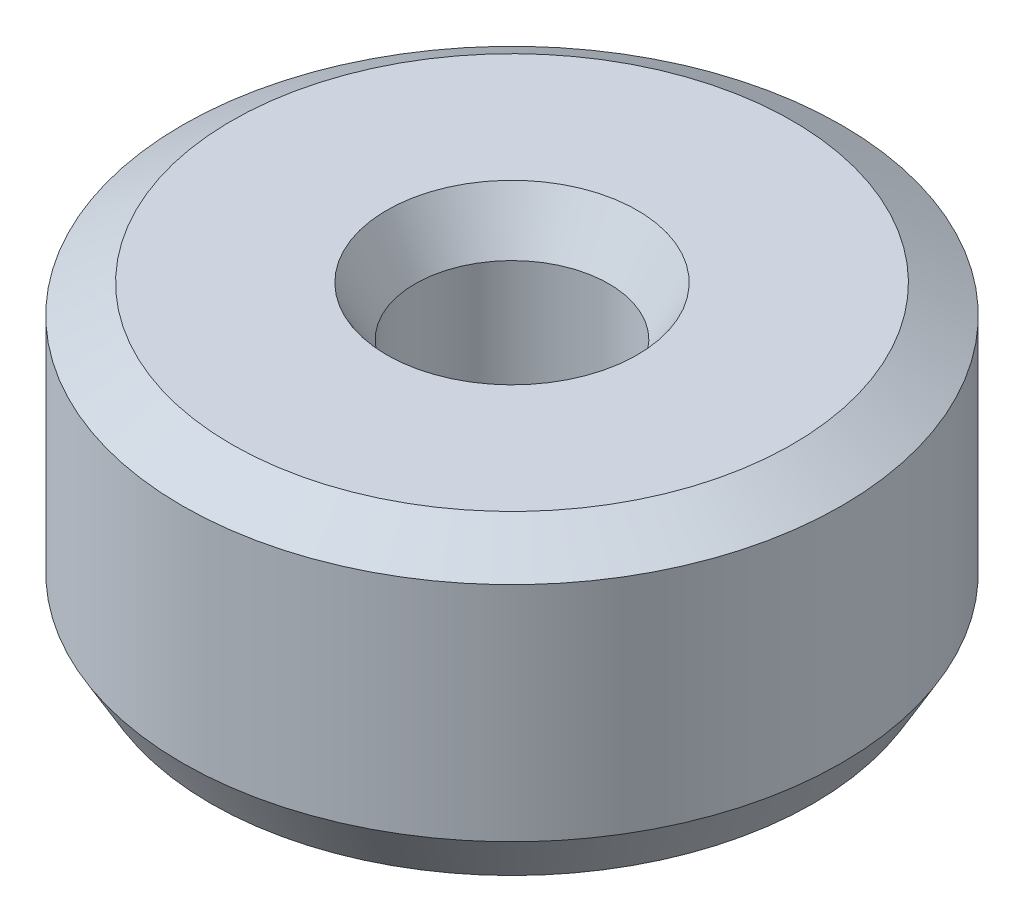
from build123d import *
from OCP.BRepFilletAPI import BRepFilletAPI_MakeChamfer

# Parameters (mm, degrees)
SKETCH1_R           = 7.5
BOSS_EXTRUDE1_DEPTH = 6.836970651
SKETCH2_R           = 2.201911408
CUT_EXTRUDE1_DEPTH  = 13.619198377
CHAMFER1_SIZE       = 0.648387447
CHAMFER1_SIZE2      = 1.123040002


with BuildPart() as part:
    # Sketch1 → Boss-Extrude1 (new body)
    with BuildSketch(Plane(origin=(0, 0, 0), x_dir=(1, 0, 0), z_dir=(0, 1, 0))):
        Circle(SKETCH1_R)
    extrude(amount=BOSS_EXTRUDE1_DEPTH)

    # Sketch2 → Cut-Extrude1 (cut, through all)
    with BuildSketch(Plane(origin=(0, 0, 0), x_dir=(1, 0, 0), z_dir=(0, 1, 0))):
        Circle(SKETCH2_R)
    extrude(amount=CUT_EXTRUDE1_DEPTH, mode=Mode.SUBTRACT)

    # Chamfer1: one chamfer whose edges measure the first distance from different faces: ONE call of the kernel's chamfer builder (chamfer() names one face for all edges)
    chamfer1_edges_1 = [part.edges().sort_by_distance(p)[0] for p in [
        (-2.201911408, 6.836970651, 0),
    ]]
    chamfer1_side_1 = [part.faces().sort_by_distance(p)[0] for p in [
        (-7.287867966, 6.836970651, 0),
    ]]
    chamfer1_edges_2 = [part.edges().sort_by_distance(p)[0] for p in [
        (-2.201911408, 0, 0),
    ]]
    chamfer1_side_2 = [part.faces().sort_by_distance(p)[0] for p in [
        (-2.201911408, 3.418485326, 0),
    ]]
    chamfer1_edges_3 = [part.edges().sort_by_distance(p)[0] for p in [
        (-7.5, 0, 0),
    ]]
    chamfer1_side_3 = [part.faces().sort_by_distance(p)[0] for p in [
        (-7.287867966, 0, 0),
    ]]
    chamfer1_edges_4 = [part.edges().sort_by_distance(p)[0] for p in [
        (-7.5, 6.836970651, 0),
    ]]
    chamfer1_side_4 = [part.faces().sort_by_distance(p)[0] for p in [
        (-7.5, 3.418485326, 0),
    ]]
    chamfer1 = BRepFilletAPI_MakeChamfer(part.part.solid().wrapped)
    for e in chamfer1_edges_1:
        chamfer1.Add(CHAMFER1_SIZE, CHAMFER1_SIZE2, e.wrapped, chamfer1_side_1[0].wrapped)  # the first distance lies on this face
    for e in chamfer1_edges_2:
        chamfer1.Add(CHAMFER1_SIZE, CHAMFER1_SIZE2, e.wrapped, chamfer1_side_2[0].wrapped)  # the first distance lies on this face
    for e in chamfer1_edges_3:
        chamfer1.Add(CHAMFER1_SIZE, CHAMFER1_SIZE2, e.wrapped, chamfer1_side_3[0].wrapped)  # the first distance lies on this face
    for e in chamfer1_edges_4:
        chamfer1.Add(CHAMFER1_SIZE, CHAMFER1_SIZE2, e.wrapped, chamfer1_side_4[0].wrapped)  # the first distance lies on this face
    add(Compound.cast(chamfer1.Shape()), mode=Mode.REPLACE)


solid = part.part
